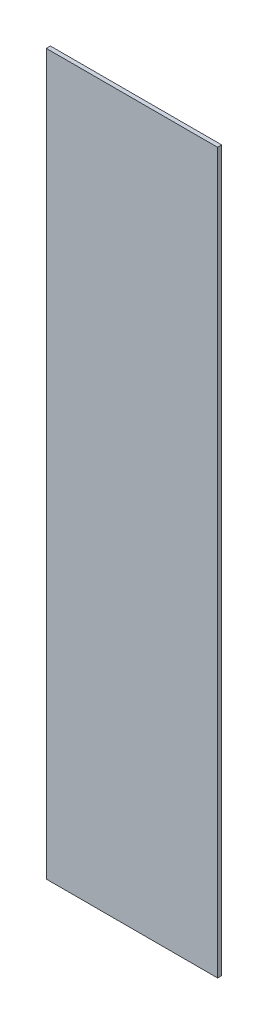
from build123d import *

# Parameters (mm, degrees)
ESBO_O1_W                = 250
ESBO_O1_H                = 1050
RESSALTO_EXTRUS_O1_DEPTH = 6


with BuildPart() as part:
    # Esboço1 → Ressalto-extrusão1 (new body)
    with BuildSketch(Plane.XY):
        with Locations((125, 525)):
            Rectangle(ESBO_O1_W, ESBO_O1_H)
    extrude(amount=RESSALTO_EXTRUS_O1_DEPTH)


solid = part.part
